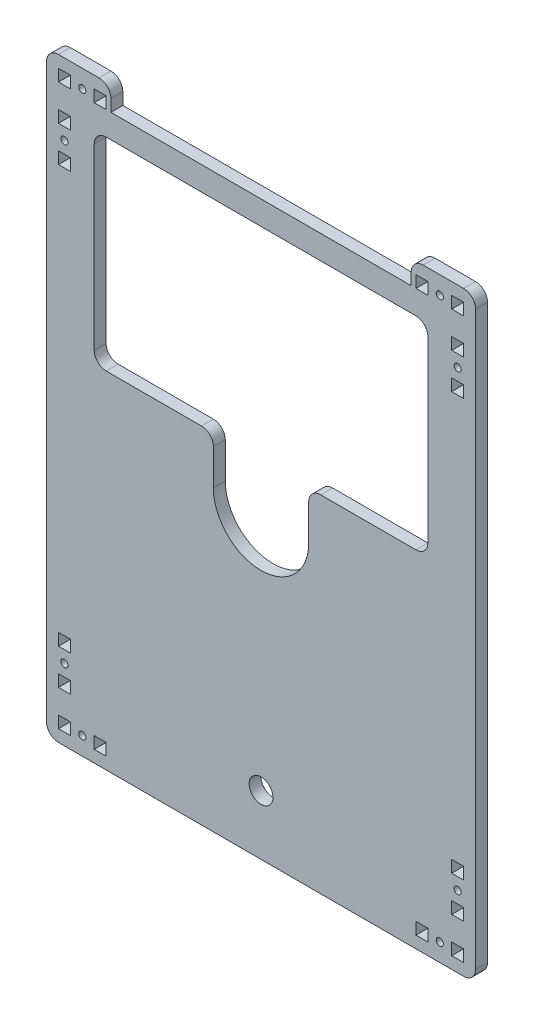
from build123d import *

# Parameters (mm, degrees)
SKETCH1_R           = 5
SKETCH1_R_2         = 1.5
SKETCH1_W           = 5
SKETCH1_H           = 5
BOSS_EXTRUDE1_DEPTH = 5
FILLET1_R           = 5


with BuildPart() as part:
    # Sketch1 → Boss-Extrude1 (new body)
    with BuildSketch(Plane.XY):
        Polygon((-90, 125), (-90, -125), (90, -125), (90, 125), (63, 125), (63, 115), (-63, 115), (-63, 125), align=None)
        with Locations((0, -100)):
            Circle(SKETCH1_R, mode=Mode.SUBTRACT)
        with Locations((-75, 117.5)):
            Circle(SKETCH1_R_2, mode=Mode.SUBTRACT)
        with Locations((-75, -117.5)):
            Circle(SKETCH1_R_2, mode=Mode.SUBTRACT)
        with Locations((75, -117.5)):
            Circle(SKETCH1_R_2, mode=Mode.SUBTRACT)
        with Locations((75, 117.5)):
            Circle(SKETCH1_R_2, mode=Mode.SUBTRACT)
        with Locations((82.5, 95)):
            Circle(SKETCH1_R_2, mode=Mode.SUBTRACT)
        with Locations((82.5, -95)):
            Circle(SKETCH1_R_2, mode=Mode.SUBTRACT)
        with Locations((-82.5, 95)):
            Circle(SKETCH1_R_2, mode=Mode.SUBTRACT)
        with Locations((-82.5, -95)):
            Circle(SKETCH1_R_2, mode=Mode.SUBTRACT)
        with BuildLine():
            Line((-70, 105), (70, 105))
            Line((70, 105), (70, 20))
            Line((70, 20), (20, 20))
            Line((20, 20), (20, 0))
            ThreePointArc((20, 0), (0, -20), (-20, 0))
            Line((-20, 0), (-20, 20))
            Line((-20, 20), (-70, 20))
            Line((-70, 20), (-70, 105))
        make_face(mode=Mode.SUBTRACT)
        with Locations((-82.5, 117.5)):
            Rectangle(SKETCH1_W, SKETCH1_H, mode=Mode.SUBTRACT)
        with Locations((-67.5, 117.5)):
            Rectangle(SKETCH1_W, SKETCH1_H, mode=Mode.SUBTRACT)
        with Locations((-82.5, -117.5)):
            Rectangle(SKETCH1_W, SKETCH1_H, mode=Mode.SUBTRACT)
        with Locations((-67.5, -117.5)):
            Rectangle(SKETCH1_W, SKETCH1_H, mode=Mode.SUBTRACT)
        with Locations((82.5, -117.5)):
            Rectangle(SKETCH1_W, SKETCH1_H, mode=Mode.SUBTRACT)
        with Locations((67.5, -117.5)):
            Rectangle(SKETCH1_W, SKETCH1_H, mode=Mode.SUBTRACT)
        with Locations((82.5, 117.5)):
            Rectangle(SKETCH1_W, SKETCH1_H, mode=Mode.SUBTRACT)
        with Locations((67.5, 117.5)):
            Rectangle(SKETCH1_W, SKETCH1_H, mode=Mode.SUBTRACT)
        with Locations((82.5, 102.5)):
            Rectangle(SKETCH1_W, SKETCH1_H, mode=Mode.SUBTRACT)
        with Locations((82.5, 87.5)):
            Rectangle(SKETCH1_W, SKETCH1_H, mode=Mode.SUBTRACT)
        with Locations((82.5, -102.5)):
            Rectangle(SKETCH1_W, SKETCH1_H, mode=Mode.SUBTRACT)
        with Locations((82.5, -87.5)):
            Rectangle(SKETCH1_W, SKETCH1_H, mode=Mode.SUBTRACT)
        with Locations((-82.5, 102.5)):
            Rectangle(SKETCH1_W, SKETCH1_H, mode=Mode.SUBTRACT)
        with Locations((-82.5, 87.5)):
            Rectangle(SKETCH1_W, SKETCH1_H, mode=Mode.SUBTRACT)
        with Locations((-82.5, -102.5)):
            Rectangle(SKETCH1_W, SKETCH1_H, mode=Mode.SUBTRACT)
        with Locations((-82.5, -87.5)):
            Rectangle(SKETCH1_W, SKETCH1_H, mode=Mode.SUBTRACT)
    extrude(amount=BOSS_EXTRUDE1_DEPTH)

    # Fillet1
    fillet1_edges = [part.edges().sort_by_distance(p)[0] for p in [
        (-90, -125, 2.5),
        (90, -125, 2.5),
        (-90, 125, 2.5),
        (-63, 125, 2.5),
        (63, 125, 2.5),
        (90, 125, 2.5),
        (-70, 105, 2.5),
        (70, 105, 2.5),
        (70, 20, 2.5),
        (20, 20, 2.5),
        (-20, 20, 2.5),
        (-70, 20, 2.5),
    ]]
    fillet(fillet1_edges, radius=FILLET1_R)


solid = part.part
